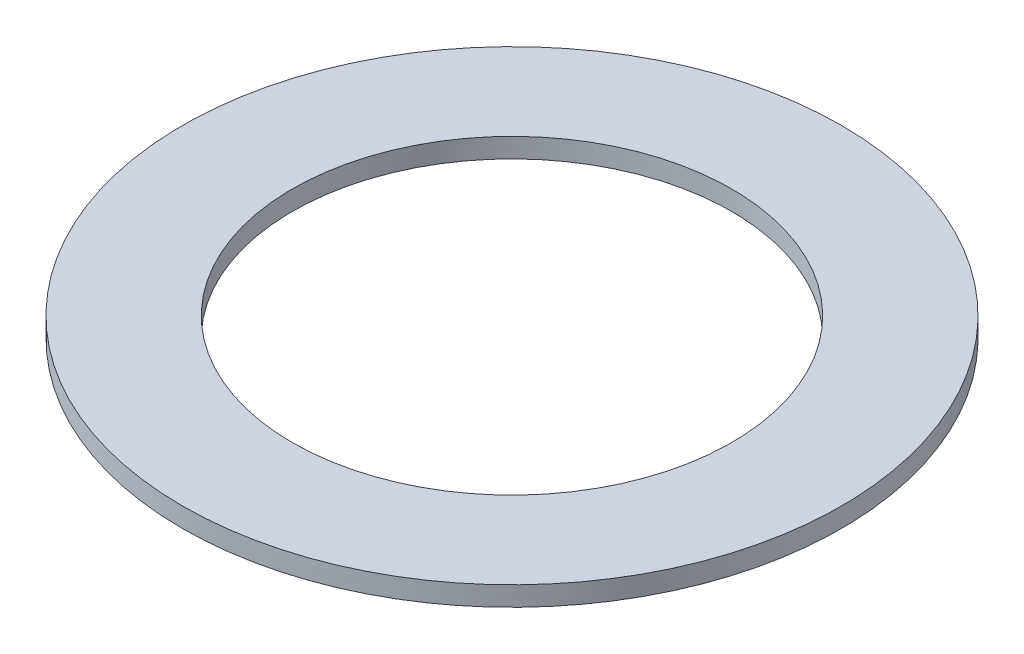
from build123d import *

# Parameters (mm, degrees)
SKETCH1_R           = 67.5
BOSS_EXTRUDE1_DEPTH = 4
SKETCH2_R           = 45
CUT_EXTRUDE1_DEPTH  = 96.543183954


with BuildPart() as part:
    # Sketch1 → Boss-Extrude1 (new body)
    with BuildSketch(Plane(origin=(0, 0, 0), x_dir=(1, 0, 0), z_dir=(0, 1, 0))):
        Circle(SKETCH1_R)
    extrude(amount=BOSS_EXTRUDE1_DEPTH)

    # Sketch2 → Cut-Extrude1 (cut, through all)
    with BuildSketch(Plane(origin=(0, 0, 0), x_dir=(1, 0, 0), z_dir=(0, 1, 0))):
        Circle(SKETCH2_R)
    extrude(amount=CUT_EXTRUDE1_DEPTH, mode=Mode.SUBTRACT)


solid = part.part
